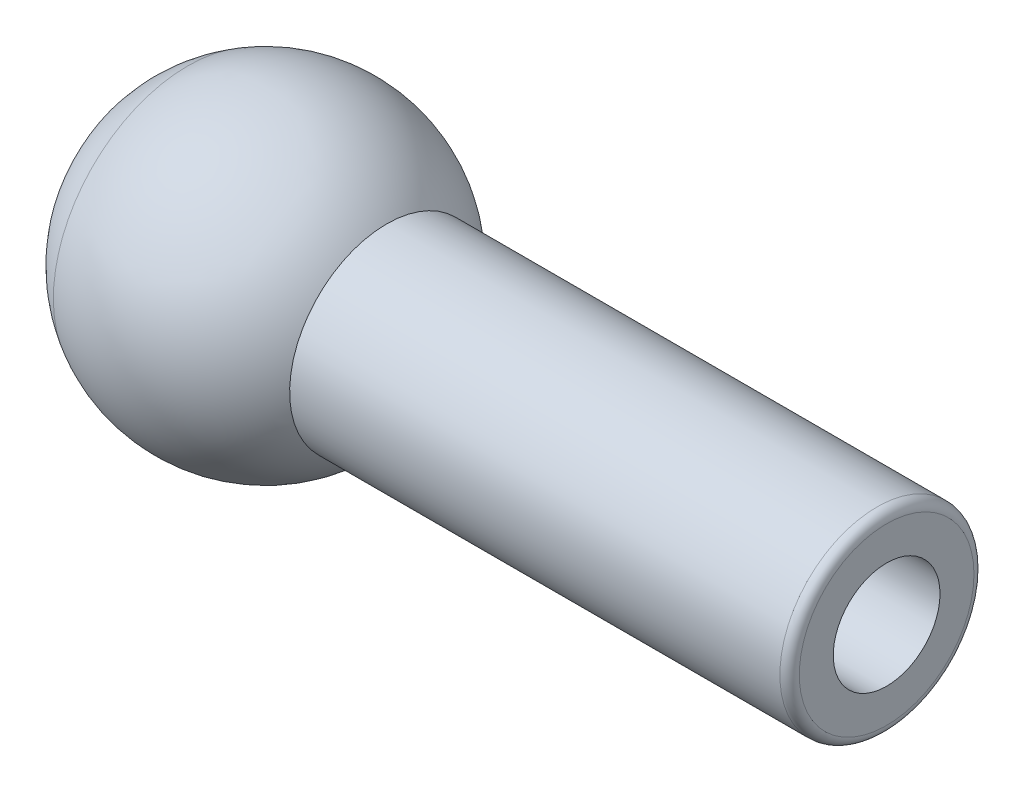
from build123d import *

# Parameters (mm, degrees)
FILLET2_R = 0.396875


# Read off the part's stored shape, not the designer's step: Split2
with BuildPart() as part:
    # Sketch1 → Revolve1 (revolve)
    with BuildSketch(Plane.XY, mode=Mode.PRIVATE) as revolve1_sk:
        with BuildLine():
            Line((0.254, 3.96875), (-4.956967161, 3.96875))
            ThreePointArc((-4.956967161, 3.96875), (0, 6.35), (4.956967161, 3.96875))
            Line((4.956967161, 3.96875), (25.4, 3.96875))
            Line((25.4, 3.96875), (25.4, 2.1828125))
            Line((25.4, 2.1828125), (0.254, 2.1828125))
            Line((0.254, 2.1828125), (0.254, 3.96875))
        make_face()
    revolve(revolve1_sk.sketch.rotate(Axis((0, 0, 0), (-1, 0, 0)), 90), axis=Axis((0, 0, 0), (-1, 0, 0)))

    # Fillet2
    fillet2_edges = [part.edges().sort_by_distance(p)[0] for p in [
        (25.4, 0, 3.96875),
    ]]
    fillet(fillet2_edges, radius=FILLET2_R)


with BuildPart() as body_2:
    # Split2: the piece on the far side of the plane
    add(part.part)
    split(bisect_by=Plane.YZ.offset(-3.175), keep=Keep.BOTTOM)


with BuildPart() as part_1:
    add(part.part)

    # Split2
    split(bisect_by=Plane.YZ.offset(-3.175), keep=Keep.TOP)


solid = Compound([body_2.part, part_1.part])
